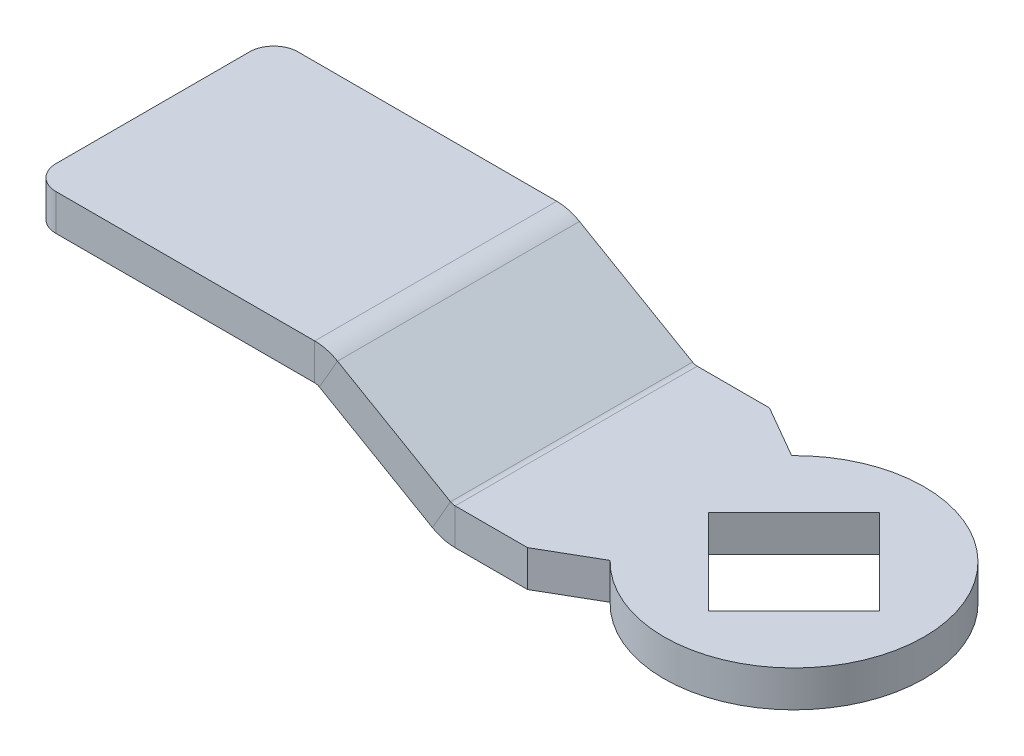
from build123d import *

# Parameters (mm, degrees)
SM_BASE_FLANGE_1_DEPTH = 3
OTHER_START            = -10
OTHER_1_DEPTH          = 20
OTHER_1_2_DEPTH        = 20
CUT_EXTRUDE_1_DEPTH    = 55.411051267
FILLET_1_R             = 2


# Read off the part's stored shape, not the designer's step: 转折1
# Sheet-metal steps are written as plain solids
with BuildPart() as part:
    # Sketch 2 → 基体-法兰1 (new body)
    with BuildSketch(Plane(origin=(0, 0, 0), x_dir=(1, 0, 0), z_dir=(0, 1, 0))):
        with BuildLine():
            Line((-12.031587919, -10), (-7.7014609, -7.5))
            ThreePointArc((-7.7014609, -7.5), (10.75, 0), (-7.7014609, 7.5))
            Line((-7.7014609, 7.5), (-12.031587919, 10))
            Line((-12.031587919, 10), (-53, 10))
            Line((-53, 10), (-53, -10))
            Line((-53, -10), (-12.031587919, -10))
        make_face()
    extrude(amount=-SM_BASE_FLANGE_1_DEPTH)

    # Other 1 outline → Other 1 (cut)
    with BuildSketch(Plane.XY.offset(OTHER_START)):
        with BuildLine():
            ThreePointArc((-18.007123317, -3), (-18.981991132, -2.871656217), (-19.890423317, -2.495371286))
            Line((-19.890423317, -2.495371286), (-24.212533168, 0))
            Line((-24.212533168, 0), (-53, 0))
            Line((-53, 0), (-53, -3))
            Line((-53, -3), (-18.007123317, -3))
        make_face()
    extrude(amount=OTHER_1_DEPTH, mode=Mode.SUBTRACT)

    # Other 1 2 outline → Other 1 2 (add)
    with BuildSketch(Plane.XY.offset(OTHER_START)):
        with BuildLine():
            Line((-29.230795442, 2.897295075), (-24.212533168, 0))
            Line((-24.212533168, 0), (-18.007123317, 0))
            ThreePointArc((-18.007123317, 0), (-18.205533997, 0.026121262), (-18.390423317, 0.102704925))
            Line((-18.390423317, 0.102704925), (-27.730795442, 5.495371286))
            ThreePointArc((-27.730795442, 5.495371286), (-28.639227627, 5.871656217), (-29.614095442, 6))
            Line((-29.614095442, 6), (-53, 6))
            Line((-53, 6), (-53, 3))
            Line((-53, 3), (-29.614095442, 3))
            ThreePointArc((-29.614095442, 3), (-29.415684762, 2.973878738), (-29.230795442, 2.897295075))
        make_face()
    extrude(amount=OTHER_1_2_DEPTH)

    # 草图8 → 切除-拉伸1 (cut, through all)
    with BuildSketch(Plane(origin=(0, 0, 0), x_dir=(1, 0, 0), z_dir=(0, 1, 0))):
        Polygon((0, 7.071067812), (-7.071067812, 0), (0, -7.071067812), (7.071067812, 0), align=None)
    extrude(amount=-CUT_EXTRUDE_1_DEPTH, mode=Mode.SUBTRACT)

    # 圆角1
    fillet_1_edges = [part.edges().sort_by_distance(p)[0] for p in [
        (-53, 4.5, 10),
        (-53, 4.5, -10),
    ]]
    fillet(fillet_1_edges, radius=FILLET_1_R)


solid = part.part
